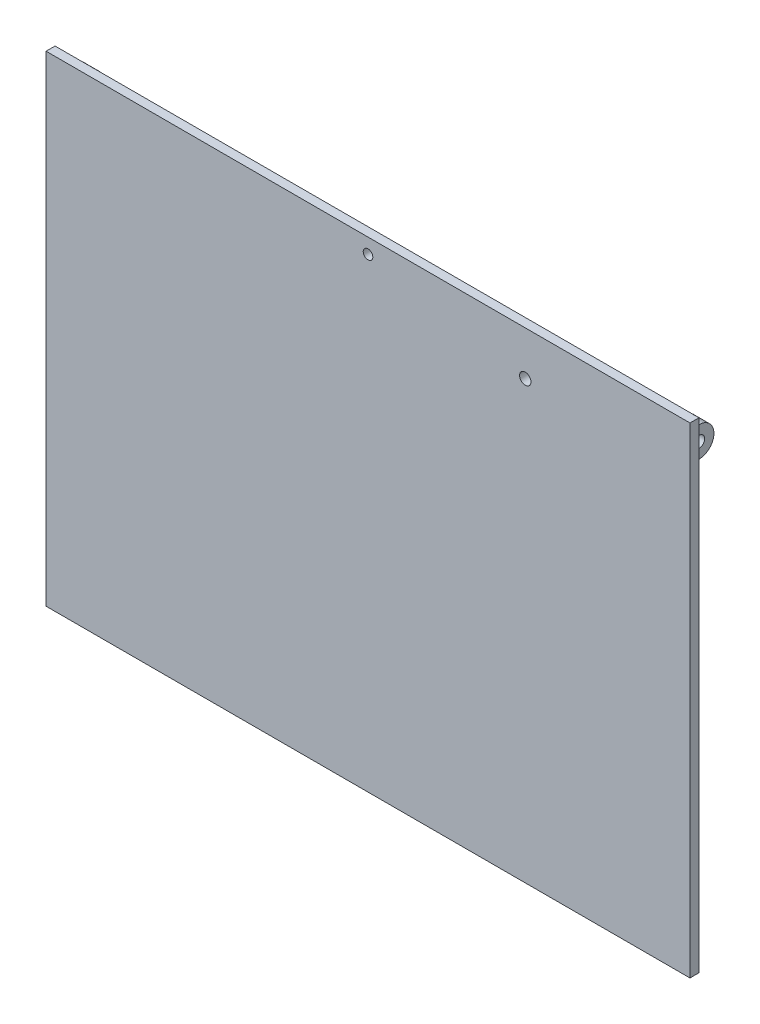
from build123d import *

# Parameters (mm, degrees)
SZKIC1_W                    = 215
SZKIC1_H                    = 160.5
DODANIE_WYCI_GNI_CIE1_DEPTH = 3
DODANIE_WYCI_GNI_CIE2_START = -3
SZKIC2_R                    = 1.9
DODANIE_WYCI_GNI_CIE2_DEPTH = 5
DODANIE_WYCI_GNI_CIE3_START = -3
SZKIC3_R                    = 1.9
DODANIE_WYCI_GNI_CIE3_DEPTH = 5
SFAZOWANIE1_SIZE            = 3
SFAZOWANIE2_START           = 8
SFAZOWANIE2_OUTLINE_R       = 1.9
SFAZOWANIE2_DEPTH           = 1.410615846
SFAZOWANIE2_START_2         = 205.589384154
SFAZOWANIE2_2_OUTLINE_R     = 1.9
SFAZOWANIE2_2_DEPTH         = 1.410615846
SFAZOWANIE2_START_3         = 10
SFAZOWANIE2_3_DEPTH         = 13
SFAZOWANIE2_START_4         = 192
SFAZOWANIE2_4_DEPTH         = 13
SFAZOWANIE2_5_OUTLINE_R     = 1.9
SFAZOWANIE2_5_DEPTH         = 148
SZKIC4_R                    = 1.6
WYTNIJ_WYCI_GNI_CIE1_DEPTH  = 10
SZKIC5_W                    = 20
SZKIC5_H                    = 5
DODANIE_WYCI_GNI_CIE4_DEPTH = 38
SZKIC6_R                    = 1.9
WYTNIJ_WYCI_GNI_CIE2_DEPTH  = 35
SFAZOWANIE3_SIZE            = 2
SZKIC7_W                    = 10
SZKIC7_H                    = 10
DODANIE_WYCI_GNI_CIE5_DEPTH = 2
SZKIC8_R                    = 1.9
WYTNIJ_WYCI_GNI_CIE3_DEPTH  = 271.705097846


with BuildPart() as part:
    # Szkic1 → Dodanie-wyciągnięcie1 (new body)
    with BuildSketch(Plane.XY):
        with Locations((107.5, 80.25)):
            Rectangle(SZKIC1_W, SZKIC1_H)
    extrude(amount=DODANIE_WYCI_GNI_CIE1_DEPTH)

    # Szkic2 → Dodanie-wyciągnięcie2 (add)
    with BuildSketch(Plane(origin=(215, 0, 0), x_dir=(0, 0, -1), z_dir=(1, 0, 0)).offset(DODANIE_WYCI_GNI_CIE2_START)):
        with BuildLine():
            Line((0, 155.5), (3.000001535, 155.5))
            ThreePointArc((3.000001535, 155.5), (8, 150.5), (3.000001535, 145.5))
            Line((3.000001535, 145.5), (0, 145.5))
            Line((0, 145.5), (0, 155.5))
        make_face()
        with Locations((3, 150.5)):
            Circle(SZKIC2_R, mode=Mode.SUBTRACT)
    dodanie_wyci_gni_cie2 = extrude(amount=-DODANIE_WYCI_GNI_CIE2_DEPTH)

    # Lustro1: Dodanie-wyciągnięcie2 across plane
    add(dodanie_wyci_gni_cie2.mirror(Plane.ZY.offset(-107.5)))

    # Szkic3 → Dodanie-wyciągnięcie3 (add)
    with BuildSketch(Plane.XZ.offset(DODANIE_WYCI_GNI_CIE3_START)):
        with BuildLine():
            Line((10, 0), (20, 0))
            Line((20, 0), (20, -3.000001569))
            ThreePointArc((20, -3.000001569), (15, -8.000001569), (10, -3.000001569))
            Line((10, -3.000001569), (10, 0))
        make_face()
        with Locations(Location((15, -3.000001569, 0), (0, 0, 270))):
            Circle(SZKIC3_R, mode=Mode.SUBTRACT)
    dodanie_wyci_gni_cie3 = extrude(amount=-DODANIE_WYCI_GNI_CIE3_DEPTH)

    # Lustro2: Dodanie-wyciągnięcie3 across plane
    add(dodanie_wyci_gni_cie3.mirror(Plane.ZY.offset(-107.5)))

    # Sfazowanie1
    sfazowanie1_edges = [part.edges().sort_by_distance(p)[0] for p in [
        (195, 5.5, 0),
        (20, 5.5, 0),
        (5.5, 145.5, 0),
        (209.5, 145.5, 0),
    ]]
    chamfer(sfazowanie1_edges, length=SFAZOWANIE1_SIZE)

    # Sfazowanie2: read off the stored shape, not the designer's step
    # Sfazowanie2 outline → Sfazowanie2 (add)
    with BuildSketch(Plane.YZ.offset(SFAZOWANIE2_START)):
        with BuildLine():
            ThreePointArc((145.5, -3.000001489), (150.499999977, -8), (155.5, -3.000001535))
            Line((155.5, -3.000001535), (155.5, 0))
            Line((155.5, 0), (142.5, 0))
            Line((142.5, 0), (145.5, -3.000001489))
        make_face()
        with Locations((150.5, -3)):
            Circle(SFAZOWANIE2_OUTLINE_R, mode=Mode.SUBTRACT)
    extrude(amount=SFAZOWANIE2_DEPTH)

    # Sfazowanie2 2 outline → Sfazowanie2 2 (add)
    with BuildSketch(Plane.YZ.offset(SFAZOWANIE2_START_2)):
        with BuildLine():
            ThreePointArc((145.5, -3.000001489), (150.499999977, -8), (155.5, -3.000001535))
            Line((155.5, -3.000001535), (155.5, 0))
            Line((155.5, 0), (142.5, 0))
            Line((142.5, 0), (145.5, -3.000001489))
        make_face()
        with Locations((150.5, -3)):
            Circle(SFAZOWANIE2_2_OUTLINE_R, mode=Mode.SUBTRACT)
    extrude(amount=SFAZOWANIE2_2_DEPTH)

    # Sfazowanie2 3 outline → Sfazowanie2 3 (add)
    with BuildSketch(Plane.YZ.offset(SFAZOWANIE2_START_3)):
        Polygon((8, -8), (9.410615846, 0), (8, 0), align=None)
    extrude(amount=SFAZOWANIE2_3_DEPTH)

    # Sfazowanie2 4 outline → Sfazowanie2 4 (add)
    with BuildSketch(Plane.YZ.offset(SFAZOWANIE2_START_4)):
        Polygon((8, -8), (9.410615846, 0), (8, 0), align=None)
    extrude(amount=SFAZOWANIE2_4_DEPTH)

    # Sfazowanie2 5 outline → Sfazowanie2 5 (cut)
    with BuildSketch(Plane(origin=(0, 0, 0), x_dir=(1, 0, 0), z_dir=(0, 1, 0)).offset(SFAZOWANIE2_START)):
        with BuildLine():
            Line((10, 10), (10, 3.000001569))
            ThreePointArc((10, 3.000001569), (15.000000024, 8.000001569), (20, 3.000001521))
            Line((20, 3.000001521), (23, 0))
            Line((23, 0), (23, 10))
            Line((23, 10), (10, 10))
        make_face()
        Polygon((9.410615846, 0), (9.410615846, 10), (7.647346039, 10), (8, 8), align=None)
        with BuildLine():
            Line((205, 10), (192, 10))
            Line((192, 10), (192, 0))
            Line((192, 0), (195, 3.000001521))
            ThreePointArc((195, 3.000001521), (199.999999976, 8.000001569), (205, 3.000001569))
            Line((205, 3.000001569), (205, 10))
        make_face()
        Polygon((207.352653962, 10), (205.589384154, 10), (205.589384154, 0), (207, 8), align=None)
        with Locations((15, 3.000001569)):
            Circle(SFAZOWANIE2_5_OUTLINE_R)
        with Locations((200, 3.000001569)):
            Circle(SFAZOWANIE2_5_OUTLINE_R)
    extrude(amount=SFAZOWANIE2_5_DEPTH, mode=Mode.SUBTRACT)

    # Szkic4 → Wytnij-wyciągnięcie1 (cut)
    with BuildSketch(Plane(origin=(0, 0, 0), x_dir=(-1, 0, 0), z_dir=(0, 0, -1))):
        with Locations((-107.5, 155.5)):
            Circle(SZKIC4_R)
    extrude(amount=-WYTNIJ_WYCI_GNI_CIE1_DEPTH, mode=Mode.SUBTRACT)

    # Szkic5 → Dodanie-wyciągnięcie4 (add)
    with BuildSketch(Plane(origin=(0, 0, 0), x_dir=(-1, 0, 0), z_dir=(0, 0, -1))):
        with Locations((-107.5, 5.5)):
            Rectangle(SZKIC5_W, SZKIC5_H)
    extrude(amount=DODANIE_WYCI_GNI_CIE4_DEPTH)

    # Szkic6 → Wytnij-wyciągnięcie2 (cut)
    with BuildSketch(Plane(origin=(0, 8, 0), x_dir=(1, 0, 0), z_dir=(0, 1, 0))):
        with Locations(Location((107.5, 15, 0), (0, 0, 270))):
            Circle(SZKIC6_R)
    extrude(amount=-WYTNIJ_WYCI_GNI_CIE2_DEPTH, mode=Mode.SUBTRACT)

    # Sfazowanie3
    sfazowanie3_edges = [part.edges().sort_by_distance(p)[0] for p in [
        (117.5, 5.5, 0),
        (97.5, 5.5, 0),
        (107.5, 8, 0),
    ]]
    chamfer(sfazowanie3_edges, length=SFAZOWANIE3_SIZE)

    # Szkic7 → Dodanie-wyciągnięcie5 (add)
    with BuildSketch(Plane(origin=(0, 0, 0), x_dir=(-1, 0, 0), z_dir=(0, 0, -1))):
        with Locations((-160, 145.8)):
            Rectangle(SZKIC7_W, SZKIC7_H)
    extrude(amount=DODANIE_WYCI_GNI_CIE5_DEPTH)

    # Szkic8 → Wytnij-wyciągnięcie3 (cut, through all)
    with BuildSketch(Plane(origin=(0, 0, -2), x_dir=(-1, 0, 0), z_dir=(0, 0, -1))):
        with Locations((-160, 145.8)):
            Circle(SZKIC8_R)
    extrude(amount=-WYTNIJ_WYCI_GNI_CIE3_DEPTH, mode=Mode.SUBTRACT)


solid = part.part
